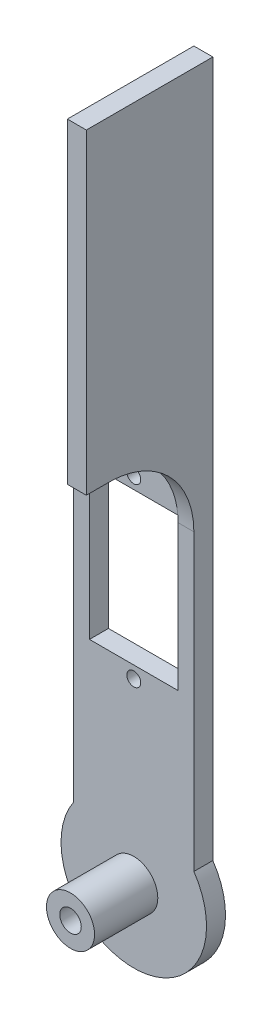
from build123d import *

# Parameters (mm, degrees)
BOSS_EXTRUDE1_DEPTH = 3
SKETCH2_R           = 3.8
BOSS_EXTRUDE2_DEPTH = 10
SKETCH3_R           = 1.7
CUT_EXTRUDE1_DEPTH  = 20
SKETCH5_R           = 1.1
SKETCH5_W           = 14
SKETCH5_H           = 24
CUT_EXTRUDE2_DEPTH  = 20
SKETCH6_W           = 3
SKETCH6_H           = 20
BOSS_EXTRUDE3_DEPTH = 50
FILLET2_START       = 7
FILLET2_DEPTH       = 2.5


with BuildPart() as part:
    # Sketch1 → Boss-Extrude1 (new body)
    with BuildSketch(Plane.XY):
        with BuildLine():
            Line((-9.5, 6.480740698), (-9.5, 66.480740698))
            Line((-9.5, 66.480740698), (9.5, 66.480740698))
            Line((9.5, 66.480740698), (9.5, 6.480740698))
            ThreePointArc((9.5, 6.480740698), (0, -11.5), (-9.5, 6.480740698))
        make_face()
    extrude(amount=BOSS_EXTRUDE1_DEPTH)

    # Sketch2 → Boss-Extrude2 (add)
    with BuildSketch(Plane.XY.offset(3)):
        Circle(SKETCH2_R)
    extrude(amount=BOSS_EXTRUDE2_DEPTH)

    # Sketch3 → Cut-Extrude1 (cut)
    with BuildSketch(Plane(origin=(0, 0, 0), x_dir=(-1, 0, 0), z_dir=(0, 0, -1))):
        Circle(SKETCH3_R)
    extrude(amount=-CUT_EXTRUDE1_DEPTH, mode=Mode.SUBTRACT)

    # Sketch5 → Cut-Extrude2 (cut)
    with BuildSketch(Plane(origin=(0, 0, 0), x_dir=(-1, 0, 0), z_dir=(0, 0, -1))):
        with Locations((0, 28.1)):
            Circle(SKETCH5_R)
        with Locations(Location((0, 55.9, 0), (0, 0, 180))):
            Circle(SKETCH5_R)
        with Locations((0, 42)):
            Rectangle(SKETCH5_W, SKETCH5_H)
    extrude(amount=-CUT_EXTRUDE2_DEPTH, mode=Mode.SUBTRACT)

    # Sketch6 → Boss-Extrude3 (add)
    with BuildSketch(Plane(origin=(0, 66.480740698, 0), x_dir=(1, 0, 0), z_dir=(0, 1, 0))):
        with Locations((8, -10)):
            Rectangle(SKETCH6_W, SKETCH6_H)
    extrude(amount=BOSS_EXTRUDE3_DEPTH)

    # Fillet2: read off the stored shape, not the designer's step
    # Fillet2 outline → Fillet2 (add)
    with BuildSketch(Plane.YZ.offset(FILLET2_START)):
        with BuildLine():
            add(Edge.make_bspline(
                [(52.980740698, 3), (66.480740698, 3), (66.480740698, 16.5)],
                knots=[0, 0, 0, 1, 1, 1], degree=2, weights=[1, 0.707106781, 1]))
            Line((52.980740698, 3), (66.480740698, 3))
            Line((66.480740698, 3), (66.480740698, 16.5))
        make_face()
    extrude(amount=FILLET2_DEPTH)


solid = part.part
